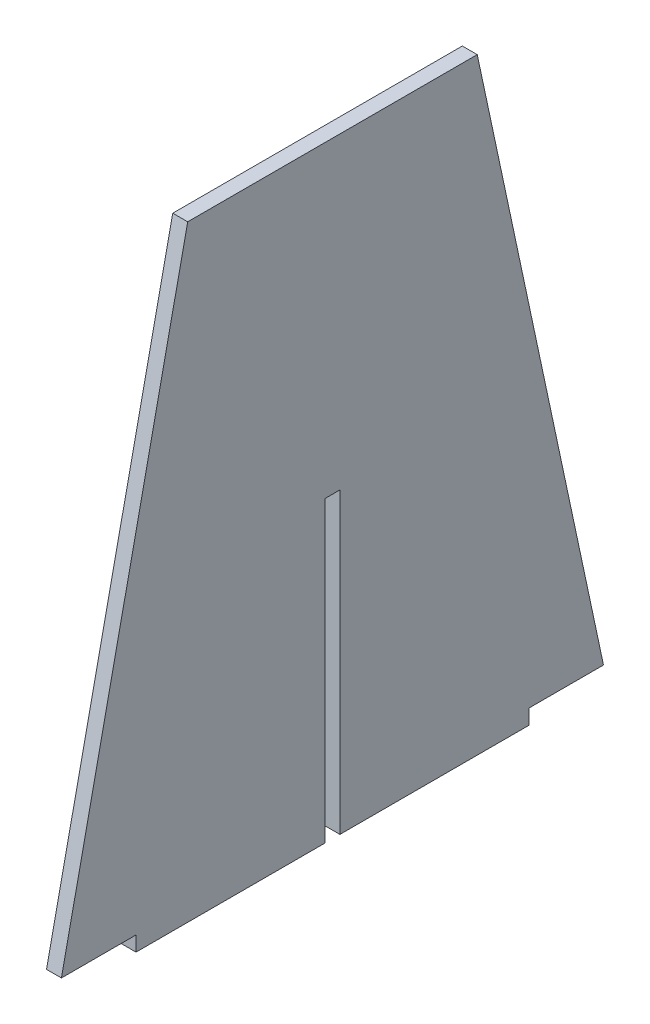
from build123d import *

# Parameters (mm, degrees)
EXTRUDE_1_DEPTH = 3


with BuildPart() as part:
    # Эскиз1 → Бобышка-Вытянуть1 (new body)
    with BuildSketch(Plane(origin=(0, 0, 0), x_dir=(0, 0, -1), z_dir=(1, 0, 0))):
        Polygon((54.5, 0), (29.113333333, 119), (-29.113333333, 119), (-54.5, 0), (-39.5, 0), (-39.5, -3), (-1.5, -3), (-1.5, 57), (1.5, 57), (1.5, -3), (39.5, -3), (39.5, 0), align=None)
    extrude(amount=EXTRUDE_1_DEPTH)


solid = part.part
